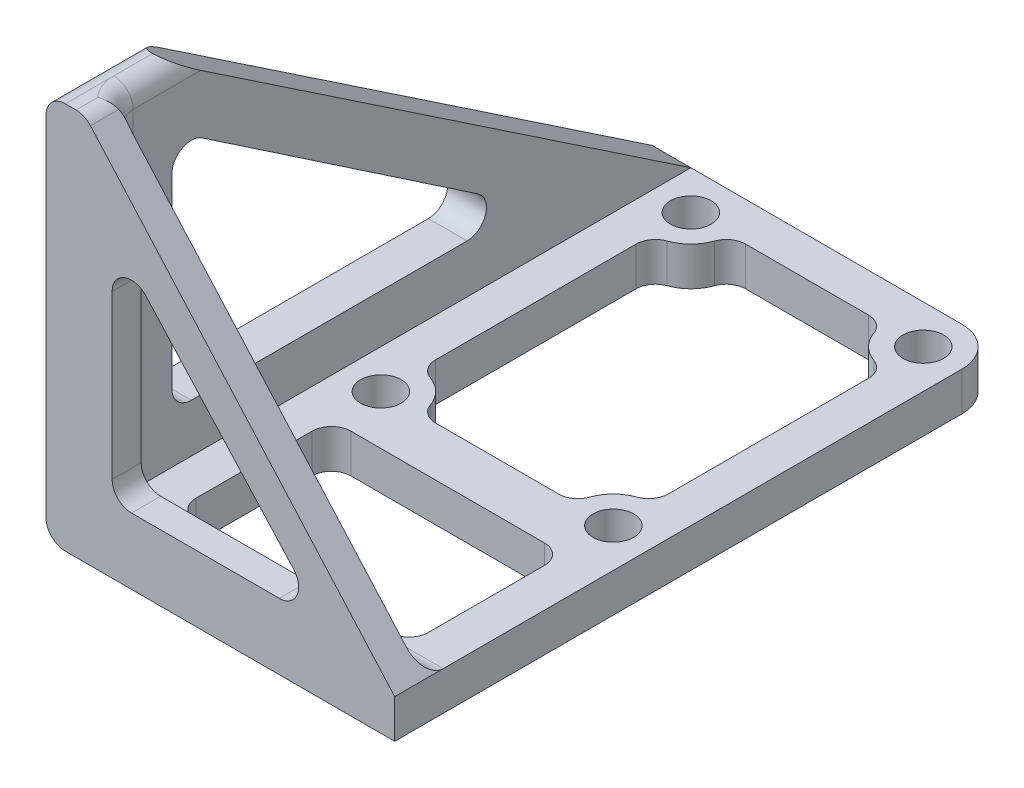
from build123d import *

# Parameters (mm, degrees)
SKETCH1_R           = 2.1
BOSS_EXTRUDE1_DEPTH = 4
SKETCH2_W           = 4
SKETCH2_H           = 79.366859707
BOSS_EXTRUDE2_DEPTH = 36
SKETCH3_W           = 16.795845367
SKETCH3_H           = 36
CUT_EXTRUDE1_DEPTH  = 20
SKETCH4_W           = 16
SKETCH4_H           = 4
BOSS_EXTRUDE3_DEPTH = 36
CUT_EXTRUDE2_DEPTH  = 20
BOSS_EXTRUDE4_DEPTH = 3
CUT_EXTRUDE3_DEPTH  = 3
SKETCH9_W           = 24
SKETCH9_H           = 16
CUT_EXTRUDE5_DEPTH  = 4
FILLET1_R           = 2
FILLET2_R           = 2
FILLET3_START       = -20
FILLET3_DEPTH       = 57.57101424
FILLET3_START_2     = 35.417415549
FILLET3_2_DEPTH     = 8.582584451
FILLET3_START_3     = 39
FILLET3_4_DEPTH     = 5


with BuildPart() as part:
    # Sketch1 → Boss-Extrude1 (new body)
    with BuildSketch(Plane(origin=(0, 0, 0), x_dir=(1, 0, 0), z_dir=(0, 1, 0))):
        with BuildLine():
            Line((-12, 20), (12, 20))
            ThreePointArc((12, 20), (14.828427125, 18.828427125), (16, 16))
            Line((16, 16), (16, -16))
            Line((16, -16), (16, -26.57101434))
            Line((16, -26.57101434), (-16, -26.57101434))
            Line((-16, -26.57101434), (-20, -26.57101434))
            Line((-20, -26.57101434), (-20, 20))
            Line((-20, 20), (-12, 20))
        make_face()
        with Locations(Location((-12, 16, 0), (0, 0, 270))):
            Circle(SKETCH1_R, mode=Mode.SUBTRACT)
        with Locations(Location((12, 16, 0), (0, 0, 270))):
            Circle(SKETCH1_R, mode=Mode.SUBTRACT)
        with Locations(Location((12, -16, 0), (0, 0, 270))):
            Circle(SKETCH1_R, mode=Mode.SUBTRACT)
        with Locations(Location((-12, -16, 0), (0, 0, 270))):
            Circle(SKETCH1_R, mode=Mode.SUBTRACT)
        with BuildLine():
            Line((-8, 16), (8, 16))
            ThreePointArc((8, 16), (9.171572875, 13.171572875), (12, 12))
            Line((12, 12), (12, -12))
            ThreePointArc((12, -12), (9.171572875, -13.171572875), (8, -16))
            Line((8, -16), (-8, -16))
            ThreePointArc((-8, -16), (-9.171572875, -13.171572875), (-12, -12))
            Line((-12, -12), (-12, 12))
            ThreePointArc((-12, 12), (-9.171572875, 13.171572875), (-8, 16))
        make_face(mode=Mode.SUBTRACT)
    extrude(amount=BOSS_EXTRUDE1_DEPTH)

    # Sketch2 → Boss-Extrude2 (add)
    with BuildSketch(Plane(origin=(0, 4, 0), x_dir=(1, 0, 0), z_dir=(0, 1, 0))):
        with Locations((-18, -19.683429854)):
            Rectangle(SKETCH2_W, SKETCH2_H)
    extrude(amount=BOSS_EXTRUDE2_DEPTH)

    # Sketch3 → Cut-Extrude1 (cut)
    with BuildSketch(Plane.ZY.offset(20)):
        Polygon((-20, 4), (33.57101434, 40), (-20, 40), align=None)
        with Locations((50.968937024, 22)):
            Rectangle(SKETCH3_W, SKETCH3_H)
    extrude(amount=-CUT_EXTRUDE1_DEPTH, mode=Mode.SUBTRACT)

    # Sketch4 → Boss-Extrude3 (add)
    with BuildSketch(Plane.ZY.offset(20)):
        with Locations((34.57101434, 2)):
            Rectangle(SKETCH4_W, SKETCH4_H)
    extrude(amount=-BOSS_EXTRUDE3_DEPTH)

    # Sketch5 → Cut-Extrude2 (cut)
    with BuildSketch(Plane.ZY.offset(20)):
        Polygon((33.57101434, 34), (33.57101434, 9), (-3.42898566, 9), align=None)
    extrude(amount=-CUT_EXTRUDE2_DEPTH, mode=Mode.SUBTRACT)

    # Sketch6 → Boss-Extrude4 (add)
    with BuildSketch(Plane.XY.offset(42.57101434)):
        Polygon((-16, 40), (-16, 4), (16, 4), align=None)
    extrude(amount=-BOSS_EXTRUDE4_DEPTH)

    # Sketch7 → Cut-Extrude3 (cut)
    with BuildSketch(Plane(origin=(0, 0, 39.57101434), x_dir=(-1, 0, 0), z_dir=(0, 0, -1))):
        Polygon((13.171572875, 6.828427125), (13.171572875, 30.828427125), (-8.598354134, 6.828427125), align=None)
    extrude(amount=-CUT_EXTRUDE3_DEPTH, mode=Mode.SUBTRACT)

    # Sketch9 → Cut-Extrude5 (cut)
    with BuildSketch(Plane.XZ):
        with Locations((0, 29.1)):
            Rectangle(SKETCH9_W, SKETCH9_H)
    extrude(amount=-CUT_EXTRUDE5_DEPTH, mode=Mode.SUBTRACT)

    # Fillet1
    fillet1_edges = [part.edges().sort_by_distance(p)[0] for p in [
        (-18, 9, -3.42898566),
        (-18, 34, 33.57101434),
        (-18, 9, 33.57101434),
        (-13.171572875, 6.828427125, 41.07101434),
        (8.598354134, 6.828427125, 41.07101434),
        (-13.171572875, 30.828427125, 41.07101434),
        (12, 2, 37.1),
        (12, 2, 21.1),
        (-12, 2, 21.1),
        (-12, 2, 37.1),
        (-8, 2, -16),
        (-12, 2, -12),
        (-12, 2, 12),
        (-8, 2, 16),
        (8, 2, 16),
        (12, 2, 12),
        (12, 2, -12),
        (8, 2, -16),
    ]]
    fillet(fillet1_edges, radius=FILLET1_R)

    # Fillet2
    fillet2_edges = [part.edges().sort_by_distance(p)[0] for p in [
        (-20, 0, 11.28550717),
        (0, 4, 39.57101434),
        (-16, 22, 39.57101434),
        (-20, 40, 38.07101434),
    ]]
    fillet(fillet2_edges, radius=FILLET2_R)

    # Fillet3: read off the stored shape, not the designer's step
    # Fillet3 outline → Fillet3 (cut)
    with BuildSketch(Plane.XY.offset(FILLET3_START)):
        with BuildLine():
            ThreePointArc((-18, 40), (-16.585786438, 39.414213562), (-16, 38))
            Line((-16, 38), (-16, 40))
            Line((-16, 40), (-18, 40))
        make_face()
    extrude(amount=FILLET3_DEPTH, mode=Mode.SUBTRACT)

    # Fillet3 2 outline → Fillet3 2 (cut)
    with BuildSketch(Plane.XY.offset(FILLET3_START_2)):
        with BuildLine():
            Line((-16, 40), (-16.898132129, 40))
            ThreePointArc((-16.898132129, 40), (-16.43660977, 39.946020841), (-16, 39.786997113))
            Line((-16, 39.786997113), (-16, 40))
        make_face()
    extrude(amount=FILLET3_2_DEPTH, mode=Mode.SUBTRACT)

    # Fillet3 3 outline → Fillet3 3 (revolve, cut)
    with BuildSketch(Plane(origin=(-14, 0, 37.57101434), x_dir=(1, 0, 0), z_dir=(0, 0, 1))):
        with BuildLine():
            Line((2, 40), (2, 38))
            ThreePointArc((2, 38), (2.585786438, 39.414213562), (4, 40))
            Line((4, 40), (2, 40))
        make_face()
    revolve(axis=Axis((-14, 0, 37.57101434), (0, 1, 0)), mode=Mode.SUBTRACT)

    # Fillet3 4 outline → Fillet3 4 (cut)
    with BuildSketch(Plane.XY.offset(FILLET3_START_3)):
        with BuildLine():
            ThreePointArc((-16, 39.786997113), (-15.679913732, 39.586172734), (-15.403313491, 39.328727678))
            Line((-15.403313491, 39.328727678), (-16, 40))
            Line((-16, 40), (-16, 39.786997113))
        make_face()
    extrude(amount=FILLET3_4_DEPTH, mode=Mode.SUBTRACT)


solid = part.part
